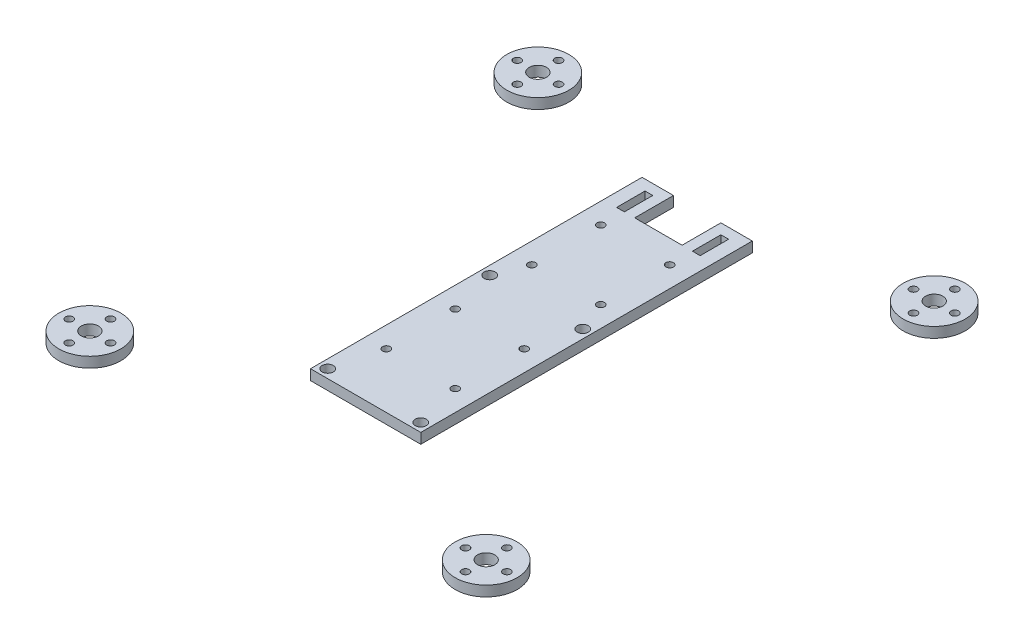
from build123d import *

# Parameters (mm, degrees)
SKETCH1_R             = 1.625
SKETCH1_W             = 2.25
SKETCH1_H             = 8.25
SKETCH1_R_2           = 1.1
BOSS_EXTRUDE1_DEPTH   = 3
SKETCH1_R_3           = 9
SKETCH1_R_4           = 2.5
BOSS_EXTRUDE1_2_DEPTH = 3
BOSS_EXTRUDE1_3_DEPTH = 3
BOSS_EXTRUDE1_4_DEPTH = 3
BOSS_EXTRUDE1_5_DEPTH = 3


with BuildPart() as part:
    # Sketch1 → Boss-Extrude1 (new body)
    with BuildSketch(Plane(origin=(0, 0, 0), x_dir=(1, 0, 0), z_dir=(0, 1, 0))):
        Polygon((16, -42.475), (16, 53.725), (6.875, 53.725), (6.875, 42.475), (-6.875, 42.475), (-6.875, 53.725), (-16, 53.725), (-16, -42.475), align=None)
        with Locations((-13.5, 7.025)):
            Circle(SKETCH1_R, mode=Mode.SUBTRACT)
        with Locations((-11, 46.6)):
            Rectangle(SKETCH1_W, SKETCH1_H, mode=Mode.SUBTRACT)
        with Locations((11, 46.6)):
            Rectangle(SKETCH1_W, SKETCH1_H, mode=Mode.SUBTRACT)
        with Locations((13.5, -39.975)):
            Circle(SKETCH1_R, mode=Mode.SUBTRACT)
        with Locations((13.5, 7.025)):
            Circle(SKETCH1_R, mode=Mode.SUBTRACT)
        with Locations((-13.5, -39.975)):
            Circle(SKETCH1_R, mode=Mode.SUBTRACT)
        with Locations((10, -6.475)):
            Circle(SKETCH1_R_2, mode=Mode.SUBTRACT)
        with Locations((-10, -6.475)):
            Circle(SKETCH1_R_2, mode=Mode.SUBTRACT)
        with Locations((-10, -26.475)):
            Circle(SKETCH1_R_2, mode=Mode.SUBTRACT)
        with Locations((10, -26.475)):
            Circle(SKETCH1_R_2, mode=Mode.SUBTRACT)
        with Locations((10, 35.75)):
            Circle(SKETCH1_R_2, mode=Mode.SUBTRACT)
        with Locations((-10, 35.75)):
            Circle(SKETCH1_R_2, mode=Mode.SUBTRACT)
        with Locations((-10, 15.75)):
            Circle(SKETCH1_R_2, mode=Mode.SUBTRACT)
        with Locations((10, 15.75)):
            Circle(SKETCH1_R_2, mode=Mode.SUBTRACT)
    extrude(amount=BOSS_EXTRUDE1_DEPTH)


with BuildPart() as body_2:
    # Sketch1 → Boss-Extrude1 2 (new body)
    with BuildSketch(Plane(origin=(0, 0, 0), x_dir=(1, 0, 0), z_dir=(0, 1, 0))):
        with Locations((-57.5, -65)):
            Circle(SKETCH1_R_3)
        with Locations((-57.5, -59)):
            Circle(SKETCH1_R_2, mode=Mode.SUBTRACT)
        with Locations((-57.5, -65)):
            Circle(SKETCH1_R_4, mode=Mode.SUBTRACT)
        with Locations((-51.5, -65)):
            Circle(SKETCH1_R_2, mode=Mode.SUBTRACT)
        with Locations((-63.5, -65)):
            Circle(SKETCH1_R_2, mode=Mode.SUBTRACT)
        with Locations((-57.5, -71)):
            Circle(SKETCH1_R_2, mode=Mode.SUBTRACT)
    extrude(amount=BOSS_EXTRUDE1_2_DEPTH)


with BuildPart() as body_3:
    # Sketch1 → Boss-Extrude1 3 (new body)
    with BuildSketch(Plane(origin=(0, 0, 0), x_dir=(1, 0, 0), z_dir=(0, 1, 0))):
        with Locations((57.5, -65)):
            Circle(SKETCH1_R_3)
        with Locations((57.5, -59)):
            Circle(SKETCH1_R_2, mode=Mode.SUBTRACT)
        with Locations((57.5, -65)):
            Circle(SKETCH1_R_4, mode=Mode.SUBTRACT)
        with Locations((51.5, -65)):
            Circle(SKETCH1_R_2, mode=Mode.SUBTRACT)
        with Locations((57.5, -71)):
            Circle(SKETCH1_R_2, mode=Mode.SUBTRACT)
        with Locations((63.5, -65)):
            Circle(SKETCH1_R_2, mode=Mode.SUBTRACT)
    extrude(amount=BOSS_EXTRUDE1_3_DEPTH)


with BuildPart() as body_4:
    # Sketch1 → Boss-Extrude1 4 (new body)
    with BuildSketch(Plane(origin=(0, 0, 0), x_dir=(1, 0, 0), z_dir=(0, 1, 0))):
        with Locations((-57.5, 65)):
            Circle(SKETCH1_R_3)
        with Locations((-51.5, 65)):
            Circle(SKETCH1_R_2, mode=Mode.SUBTRACT)
        with Locations((-57.5, 71)):
            Circle(SKETCH1_R_2, mode=Mode.SUBTRACT)
        with Locations((-63.5, 65)):
            Circle(SKETCH1_R_2, mode=Mode.SUBTRACT)
        with Locations((-57.5, 59)):
            Circle(SKETCH1_R_2, mode=Mode.SUBTRACT)
        with Locations((-57.5, 65)):
            Circle(SKETCH1_R_4, mode=Mode.SUBTRACT)
    extrude(amount=BOSS_EXTRUDE1_4_DEPTH)


with BuildPart() as body_5:
    # Sketch1 → Boss-Extrude1 5 (new body)
    with BuildSketch(Plane(origin=(0, 0, 0), x_dir=(1, 0, 0), z_dir=(0, 1, 0))):
        with Locations((57.5, 65)):
            Circle(SKETCH1_R_3)
        with Locations((51.5, 65)):
            Circle(SKETCH1_R_2, mode=Mode.SUBTRACT)
        with Locations((57.5, 65)):
            Circle(SKETCH1_R_4, mode=Mode.SUBTRACT)
        with Locations((57.5, 59)):
            Circle(SKETCH1_R_2, mode=Mode.SUBTRACT)
        with Locations((57.5, 71)):
            Circle(SKETCH1_R_2, mode=Mode.SUBTRACT)
        with Locations((63.5, 65)):
            Circle(SKETCH1_R_2, mode=Mode.SUBTRACT)
    extrude(amount=BOSS_EXTRUDE1_5_DEPTH)


solid = Compound([part.part, body_2.part, body_3.part, body_4.part, body_5.part])
